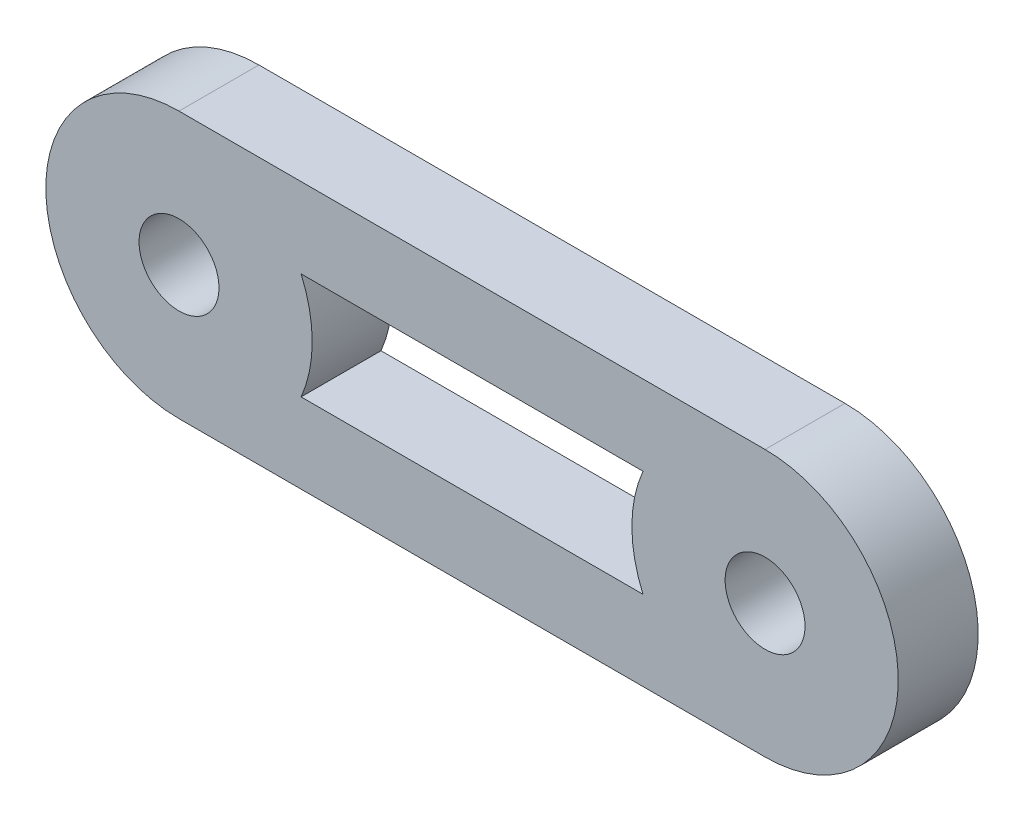
from build123d import *

# Parameters (mm, degrees)
SKETCH1_R          = 1.5
EXTRUDE1_DEPTH     = 3
CUT_EXTRUDE1_START = -10
CUT_EXTRUDE1_DEPTH = 10


with BuildPart() as part:
    # Sketch1 → Extrude1 (new body)
    with BuildSketch(Plane.XY):
        with BuildLine():
            ThreePointArc((0, 5), (-5, 0), (0, -5))
            Line((0, -5), (22, -5))
            ThreePointArc((22, -5), (27, 0), (22, 5))
            Line((22, 5), (0, 5))
        make_face()
        Circle(SKETCH1_R, mode=Mode.SUBTRACT)
        with BuildLine():
            ThreePointArc((23.5, 0), (22, -1.5), (20.5, 0))
            ThreePointArc((20.5, 0), (22, 1.5), (23.5, 0))
        make_face(mode=Mode.SUBTRACT)
    extrude(amount=EXTRUDE1_DEPTH)

    # Sketch2 → Cut-Extrude1 (cut)
    with BuildSketch(Plane.XY.offset(3).offset(CUT_EXTRUDE1_START)):
        with BuildLine():
            Line((4.582575695, -2), (17.417424305, -2))
            ThreePointArc((17.417424305, -2), (17, 0), (17.417424305, 2))
            Line((17.417424305, 2), (4.582575695, 2))
            ThreePointArc((4.582575695, 2), (5, 0), (4.582575695, -2))
        make_face()
    extrude(amount=CUT_EXTRUDE1_DEPTH, mode=Mode.SUBTRACT)


solid = part.part
